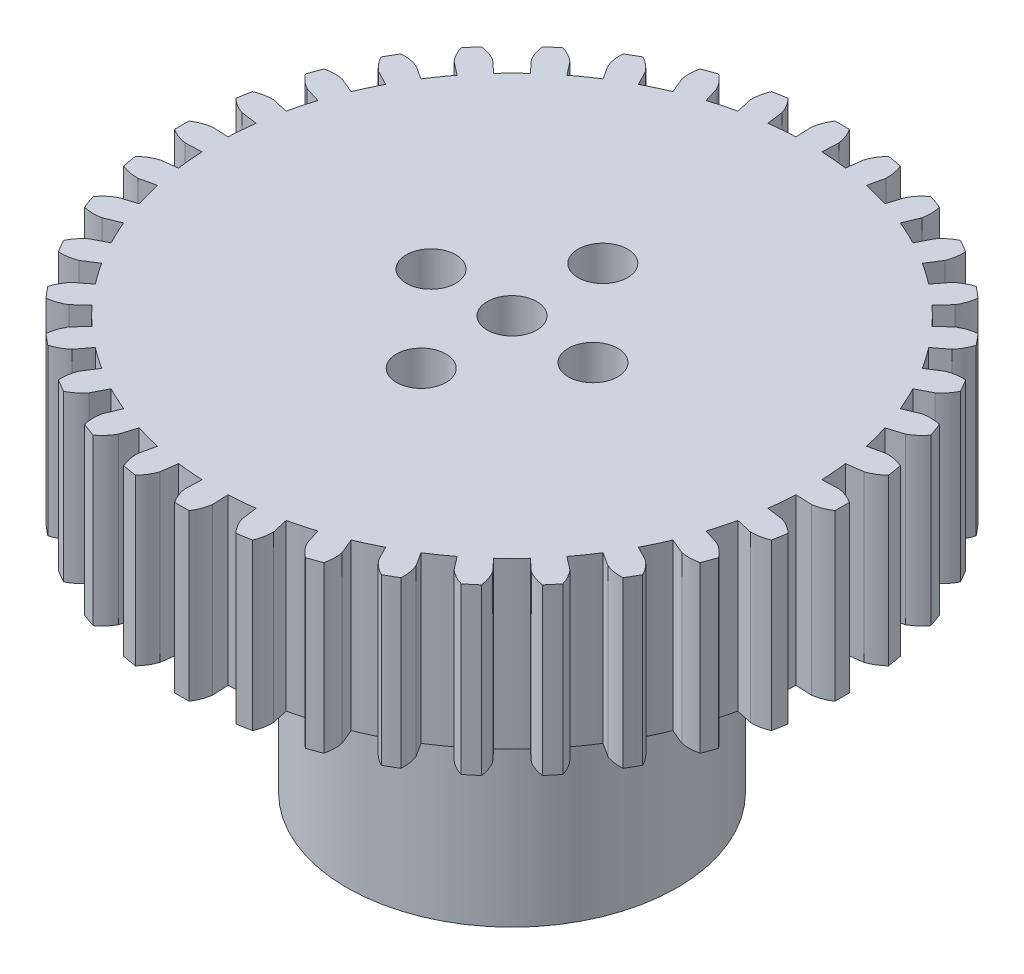
from build123d import *

# Parameters (mm, degrees)
BOSS_EXTRUDE1_DEPTH = 10
CIRPATTERN1_COUNT   = 36
SKETCH4_R           = 10
BOSS_EXTRUDE2_DEPTH = 15
SKETCH5_R           = 1.5
CUT_EXTRUDE2_DEPTH  = 38.749172176


with BuildPart() as part:
    # Sketch1 → Boss-Extrude1 (new body)
    with BuildSketch(Plane(origin=(0, 0, 0), x_dir=(1, 0, 0), z_dir=(0, 1, 0))):
        with BuildLine():
            Line((17.982867988, 0.785148973), (18.98191621, 0.82876836))
            ThreePointArc((18.98191621, 0.82876836), (19.510444819, 0.688990241), (19.995240542, 0.436297701))
            ThreePointArc((19.995240542, 0.436297701), (20, 0), (19.995240542, -0.436297701))
            ThreePointArc((19.995240542, -0.436297701), (19.510444819, -0.688990241), (18.98191621, -0.82876836))
            Line((18.98191621, -0.82876836), (17.982867988, -0.785148973))
            ThreePointArc((17.982867988, -0.785148973), (17.961460618, -1.177256326), (17.931504566, -1.568803369))
            Line((17.931504566, -1.568803369), (0, 0))
            Line((0, 0), (17.931504566, 1.568803369))
            ThreePointArc((17.931504566, 1.568803369), (17.961460618, 1.177256326), (17.982867988, 0.785148973))
        make_face()
    boss_extrude1 = extrude(amount=BOSS_EXTRUDE1_DEPTH)

    # CirPattern1: Boss-Extrude1 ×36 about axis
    cirpattern1_axis = Axis((0, 10, 0), (0, -1, 0))
    for i in range(1, CIRPATTERN1_COUNT):
        add(boss_extrude1.rotate(cirpattern1_axis, i * 360 / CIRPATTERN1_COUNT))

    # Sketch4 → Boss-Extrude2 (add)
    with BuildSketch(Plane.XZ):
        Circle(SKETCH4_R)
    extrude(amount=BOSS_EXTRUDE2_DEPTH)

    # Sketch5 → Cut-Extrude2 (cut, through all)
    with BuildSketch(Plane.XZ.offset(15)):
        Circle(SKETCH5_R)
        with Locations((-4.905, 0)):
            Circle(SKETCH5_R)
        with Locations((4.905, 0)):
            Circle(SKETCH5_R)
        with Locations((0, 5.5)):
            Circle(SKETCH5_R)
        with Locations((0, -5.5)):
            Circle(SKETCH5_R)
    extrude(amount=-CUT_EXTRUDE2_DEPTH, mode=Mode.SUBTRACT)


solid = part.part
